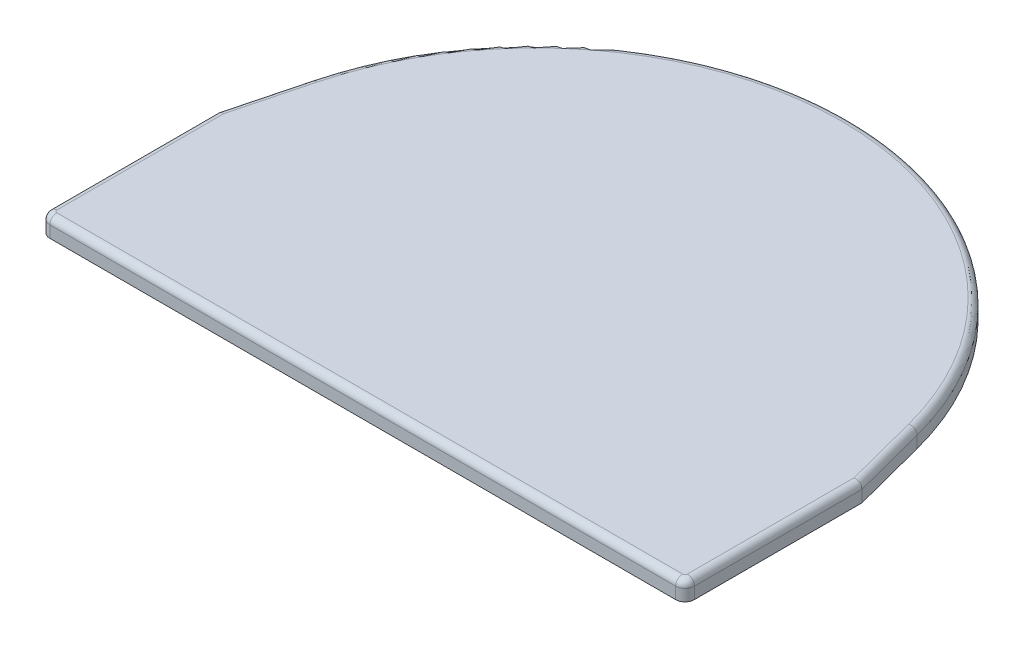
from build123d import *

# Parameters (mm, degrees)
BOSS_EXTRUDE1_DEPTH = 2.75
SKETCH12_W          = 30
SKETCH12_H          = 1.5
BOSS_EXTRUDE4_DEPTH = 1
FILLET7_R           = 0.75
FILLET8_R           = 0.75
BOSS_EXTRUDE5_DEPTH = 2
WRAP4_SECTION_W     = 1
WRAP4_SECTION_H     = 1.5
WRAP4_ANGLE         = 36.902366466
FILLET12_R          = 1
FILLET14_R          = 2
FILLET19_R          = 0.75
FILLET20_R          = 0.75
FILLET21_R          = 0.75
CUT_EXTRUDE1_DEPTH  = 3
FILLET22_R          = 1
FILLET23_R          = 1
FILLET24_R          = 0.75


with BuildPart() as part:
    # Sketch2 → Boss-Extrude1 (new body)
    with BuildSketch(Plane(origin=(0, 0, 0), x_dir=(1, 0, 0), z_dir=(0, 1, 0))):
        with BuildLine():
            Line((-62.108092304, -55.371051932), (-60.156479401, -62.867404741))
            Line((-60.156479401, -62.867404741), (-60.156479401, -77.303386301))
            Line((-60.156479401, -77.303386301), (-121.156479401, -77.303386301))
            Line((-121.156479401, -77.303386301), (-121.156479401, -62.867404741))
            Line((-121.156479401, -62.867404741), (-119.204866498, -55.371051932))
            ThreePointArc((-119.204866498, -55.371051932), (-90.656479401, -33.303386301), (-62.108092304, -55.371051932))
        make_face()
    extrude(amount=BOSS_EXTRUDE1_DEPTH)

    # Sketch12 → Boss-Extrude4 (add)
    with BuildSketch(Plane.XY.offset(77.303386301)):
        with Locations((-90.656479401, 0.75)):
            Rectangle(SKETCH12_W, SKETCH12_H)
    extrude(amount=BOSS_EXTRUDE4_DEPTH)

    # Fillet7
    fillet7_edges = [part.edges().sort_by_distance(p)[0] for p in [
        (-75.656479401, 0.75, 78.303386301),
        (-105.656479401, 0.75, 78.303386301),
    ]]
    fillet(fillet7_edges, radius=FILLET7_R)

    # Fillet8
    fillet8_edges = [part.edges().sort_by_distance(p)[0] for p in [
        (-105.656479401, 0, 77.428386301),
        (-105.436809487, 0, 78.083716387),
        (-75.656479401, 0, 77.428386301),
        (-75.876149315, 0, 78.083716387),
        (-75.656479401, 1.5, 77.428386301),
        (-75.876149315, 1.5, 78.083716387),
        (-105.656479401, 1.5, 77.428386301),
        (-105.436809487, 1.5, 78.083716387),
        (-90.656479401, 0, 78.303386301),
        (-90.656479401, 1.5, 78.303386301),
    ]]
    fillet(fillet8_edges, radius=FILLET8_R - 0.0001)  # a hair under: the kernel refuses the full size

    # Sketch13 → Boss-Extrude5 (add)
    with BuildSketch(Plane(origin=(0, 2.75, 0), x_dir=(1, 0, 0), z_dir=(0, 1, 0))):
        with BuildLine():
            Line((-58.237124562, -54.36327778), (-56.156479401, -62.355257221))
            Line((-56.156479401, -62.355257221), (-56.156479401, -81.303386301))
            Line((-56.156479401, -81.303386301), (-125.156479401, -81.303386301))
            Line((-125.156479401, -81.303386301), (-125.156479401, -62.355257221))
            Line((-125.156479401, -62.355257221), (-123.075834239, -54.36327778))
            ThreePointArc((-123.075834239, -54.36327778), (-90.656479401, -29.303386301), (-58.237124562, -54.36327778))
        make_face()
    extrude(amount=BOSS_EXTRUDE5_DEPTH)

    # Wrap4 section (on wrap section) → Wrap4 (revolve)
    with BuildSketch(Plane(origin=(-90.656479401, 0, 62.803386301), x_dir=(-0.3164965569528064, 0, -0.9485936587585957), z_dir=(-0.9485936587585957, 0, 0.3164965569528064))):
        with Locations((30, -0.75)):
            Rectangle(WRAP4_SECTION_W, WRAP4_SECTION_H)
    revolve(axis=Axis((-90.656479401, 0, 62.803386301), (0, -1, 0)), revolution_arc=WRAP4_ANGLE)

    # Fillet12
    fillet12_edges = [part.edges().sort_by_distance(p)[0] for p in [
        (-125.156479401, 3.75, 81.303386301),
        (-56.156479401, 3.75, 81.303386301),
    ]]
    fillet(fillet12_edges, radius=FILLET12_R)

    # Fillet14
    fillet14_edges = [part.edges().sort_by_distance(p)[0] for p in [
        (-121.156479401, 1.375, 77.303386301),
        (-60.156479401, 1.375, 77.303386301),
    ]]
    fillet(fillet14_edges, radius=FILLET14_R)

    # Fillet19
    fillet19_edges = [part.edges().sort_by_distance(p)[0] for p in [
        (-100.309624388, 0.75, 33.871279709),
        (-81.003334414, 0.75, 33.871279709),
    ]]
    fillet(fillet19_edges, radius=FILLET19_R)

    # Fillet20
    fillet20_edges = [part.edges().sort_by_distance(p)[0] for p in [
        (-81.281765183, 0, 34.705783772),
        (-81.281765183, 1.5, 34.705783772),
        (-90.656479401, 1.5, 32.303386301),
        (-100.031193618, 1.5, 34.705783772),
        (-90.656479401, 0, 32.303386301),
        (-100.031193618, 0, 34.705783772),
        (-100.024450454, 1.5, 34.010670695),
        (-81.288508347, 1.5, 34.010670695),
        (-100.024450454, 0, 34.010670695),
        (-81.288508347, 0, 34.010670695),
    ]]
    fillet(fillet20_edges, radius=FILLET20_R - 0.0001)  # a hair under: the kernel refuses the full size

    # Fillet21
    fillet21_edges = [part.edges().sort_by_distance(p)[0] for p in [
        (-90.656479401, 4.75, 81.303386301),
        (-56.156479401, 4.75, 71.329321761),
        (-56.44937262, 4.75, 81.010493082),
        (-124.863586182, 4.75, 81.010493082),
        (-90.656479401, 4.75, 29.303386301),
        (-124.11615682, 4.75, 58.359267501),
        (-125.156479401, 4.75, 71.329321761),
        (-57.196801981, 4.75, 58.359267501),
    ]]
    fillet(fillet21_edges, radius=FILLET21_R)

    # Sketch16 → Cut-Extrude1 (cut)
    with BuildSketch(Plane.XZ):
        with BuildLine():
            Line((-113.156479401, 67.303386301), (-68.156479401, 67.303386301))
            ThreePointArc((-68.156479401, 67.303386301), (-90.656479401, 44.803386301), (-113.156479401, 67.303386301))
        make_face()
    extrude(amount=-CUT_EXTRUDE1_DEPTH, mode=Mode.SUBTRACT)

    # Fillet22
    fillet22_edges = [part.edges().sort_by_distance(p)[0] for p in [
        (-90.656479401, 3, 44.803386301),
        (-90.656479401, 3, 67.303386301),
    ]]
    fillet(fillet22_edges, radius=FILLET22_R)

    # Fillet23
    fillet23_edges = [part.edges().sort_by_distance(p)[0] for p in [
        (-90.656479401, 0, 44.803386301),
        (-90.656479401, 0, 67.303386301),
    ]]
    fillet(fillet23_edges, radius=FILLET23_R)

    # Fillet24
    fillet24_edges = [part.edges().sort_by_distance(p)[0] for p in [
        (-111.948762062, 0, 42.385533841),
        (-120.180672949, 0, 59.119228337),
        (-121.156479401, 0, 69.085395521),
        (-120.570692963, 0, 76.717599863),
        (-112.031529401, 0, 77.303386301),
        (-69.281429401, 0, 77.303386301),
        (-60.742265838, 0, 76.717599863),
        (-60.156479401, 0, 69.085395521),
        (-61.132285852, 0, 59.119228337),
        (-69.36419674, 0, 42.385533841),
    ]]
    fillet(fillet24_edges, radius=FILLET24_R - 0.0001)  # a hair under: the kernel refuses the full size


solid = part.part
